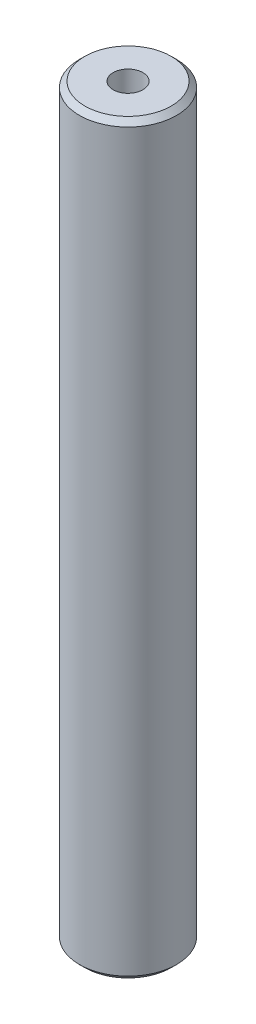
from build123d import *

# Parameters (mm, degrees)
SKETCH1_R           = 15
BOSS_EXTRUDE1_DEPTH = 230.461337919
SKETCH2_R           = 4.599254251
CUT_EXTRUDE1_DEPTH  = 232.435581265
CHAMFER1_SIZE       = 1.671960839


with BuildPart() as part:
    # Sketch1 → Boss-Extrude1 (new body)
    with BuildSketch(Plane(origin=(0, 0, 0), x_dir=(1, 0, 0), z_dir=(0, 1, 0))):
        Circle(SKETCH1_R)
    extrude(amount=BOSS_EXTRUDE1_DEPTH)

    # Sketch2 → Cut-Extrude1 (cut, through all)
    with BuildSketch(Plane(origin=(0, 0, 0), x_dir=(1, 0, 0), z_dir=(0, 1, 0))):
        Circle(SKETCH2_R)
    extrude(amount=CUT_EXTRUDE1_DEPTH, mode=Mode.SUBTRACT)

    # Chamfer1
    chamfer1_edges = [part.edges().sort_by_distance(p)[0] for p in [
        (-15, 230.461337919, 0),
        (-15, 0, 0),
    ]]
    chamfer(chamfer1_edges, length=CHAMFER1_SIZE)


solid = part.part
